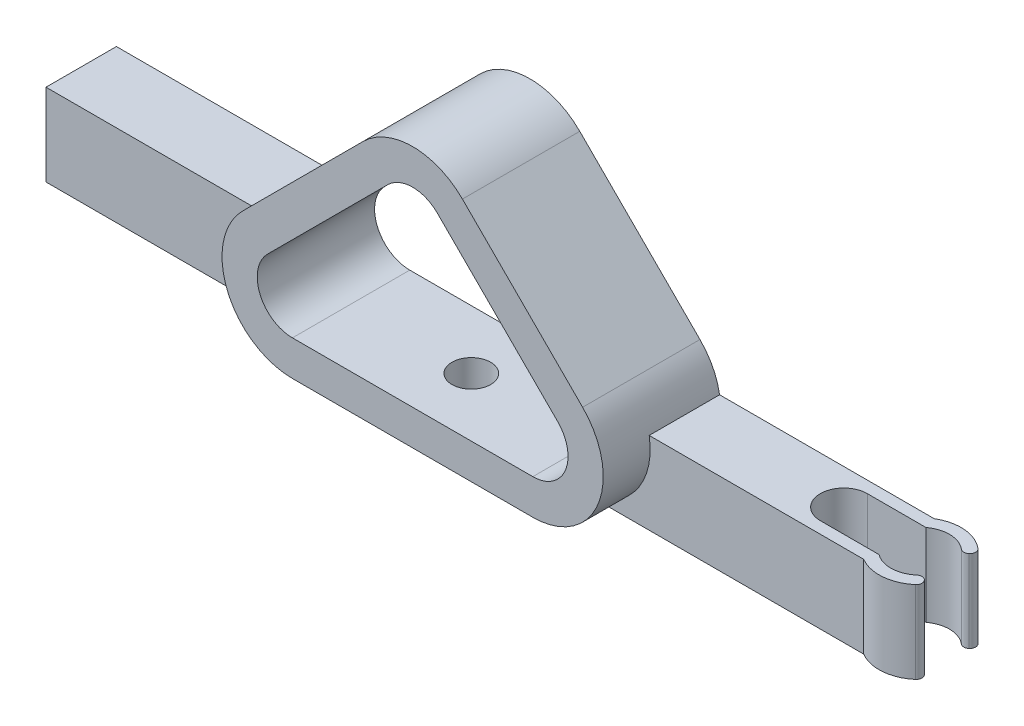
from build123d import *

# Parameters (mm, degrees)
BOSS_EXTRU_4_DEPTH      = 10
TROU_TARAUD_M43_REACH   = 29.992
TROU_TARAUD_M43_BORE_R  = 1.65
BOSS_EXTRU_5_DEPTH      = 6
BOSS_EXTRU_8_DEPTH      = 7
CONG_1_R                = 0.5
ENL_V_MAT_EXTRU_1_DEPTH = 46.732281958


with BuildPart() as part:
    # Esquisse5 → Boss.-Extru.4 (new body)
    with BuildSketch(Plane.XY):
        with BuildLine():
            Line((-14.485281374, -1.757359313), (-4.242640687, 8.485281374))
            ThreePointArc((-4.242640687, 8.485281374), (0, 10.242640687), (4.242640687, 8.485281374))
            Line((4.242640687, 8.485281374), (14.485281374, -1.757359313))
            ThreePointArc((14.485281374, -1.757359313), (15.785917882, -8.296100594), (10.242640687, -12))
            Line((10.242640687, -12), (-10.242640687, -12))
            ThreePointArc((-10.242640687, -12), (-15.785917882, -8.296100594), (-14.485281374, -1.757359313))
        make_face()
        with BuildLine():
            Line((10.242640687, -9), (-10.242640687, -9))
            ThreePointArc((-10.242640687, -9), (-13.014279285, -7.148050297), (-12.363961031, -3.878679656))
            Line((-12.363961031, -3.878679656), (-2.121320344, 6.363961031))
            ThreePointArc((-2.121320344, 6.363961031), (0, 7.242640687), (2.121320344, 6.363961031))
            Line((2.121320344, 6.363961031), (12.363961031, -3.878679656))
            ThreePointArc((12.363961031, -3.878679656), (13.014279285, -7.148050297), (10.242640687, -9))
        make_face(mode=Mode.SUBTRACT)
    extrude(amount=BOSS_EXTRU_4_DEPTH)

    # Trou taraudé M43 bore (on position points) → Trou taraudé M43 (cut, up to next)
    with BuildSketch(Plane(origin=(0, -12, 5), x_dir=(0, 0, -1), z_dir=(0, -1, 0)), mode=Mode.PRIVATE) as trou_taraud_m43_sk1:
        Circle(TROU_TARAUD_M43_BORE_R)
    trou_taraud_m43_tool1 = extrude(trou_taraud_m43_sk1.sketch, amount=-TROU_TARAUD_M43_REACH, mode=Mode.PRIVATE) & part.part
    add(trou_taraud_m43_tool1.solids().sort_by_distance((0, -12, 5))[0], mode=Mode.SUBTRACT)

    # Esquisse13 → Boss.-Extru.5 (add)
    with BuildSketch(Plane.XY):
        with BuildLine():
            Line((-10.242640687, -12), (-35.242640687, -12))
            Line((-35.242640687, -12), (-35.242640687, -5))
            Line((-35.242640687, -5), (-16.15872047, -5))
            ThreePointArc((-16.15872047, -5), (-14.825216382, -9.872983346), (-10.242640687, -12))
        make_face()
        with BuildLine():
            Line((10.242640687, -12), (30.242640687, -12))
            Line((30.242640687, -12), (30.242640687, -5))
            Line((30.242640687, -5), (16.15872047, -5))
            ThreePointArc((16.15872047, -5), (14.825216382, -9.872983346), (10.242640687, -12))
        make_face()
    extrude(amount=BOSS_EXTRU_5_DEPTH)

    # Esquisse18 → Boss.-Extru.8 (add)
    with BuildSketch(Plane(origin=(0, -12, 0), x_dir=(-1, 0, 0), z_dir=(0, -1, 0))):
        with BuildLine():
            Line((-30.242640687, 0), (-34.439865049, 0))
            ThreePointArc((-34.439865049, 0), (-36.820225395, 0.452013312), (-38.923796238, -0.750243366))
            Line((-38.923796238, -0.750243366), (-38.157751795, -1.393030976))
            ThreePointArc((-38.157751795, -1.393030976), (-33.742640687, -3), (-38.157751795, -4.606969024))
            Line((-38.157751795, -4.606969024), (-38.923796238, -5.249756634))
            ThreePointArc((-38.923796238, -5.249756634), (-36.820225395, -6.452013312), (-34.439865049, -6))
            Line((-34.439865049, -6), (-30.242640687, -6))
            Line((-30.242640687, -6), (-30.242640687, 0))
        make_face()
    extrude(amount=-BOSS_EXTRU_8_DEPTH)

    # Congé1
    cong_1_edges = [part.edges().sort_by_distance(p)[0] for p in [
        (38.157751795, -8.5, 1.393030976),
        (38.923796238, -8.5, 0.750243366),
        (38.923796238, -8.5, 5.249756634),
        (38.157751795, -8.5, 4.606969024),
    ]]
    fillet(cong_1_edges, radius=CONG_1_R - 0.0001)  # a hair under: the kernel refuses the full size

    # Esquisse19 → Enlèv. mat.-Extru.1 (cut, through all)
    with BuildSketch(Plane.XZ.offset(12)):
        with BuildLine():
            Line((29.742640687, 1), (34.742640687, 1))
            ThreePointArc((34.742640687, 1), (33.742640687, 3), (34.742640687, 5))
            Line((34.742640687, 5), (29.742640687, 5))
            ThreePointArc((29.742640687, 5), (27.742640687, 3), (29.742640687, 1))
        make_face()
    extrude(amount=-ENL_V_MAT_EXTRU_1_DEPTH, mode=Mode.SUBTRACT)


solid = part.part
